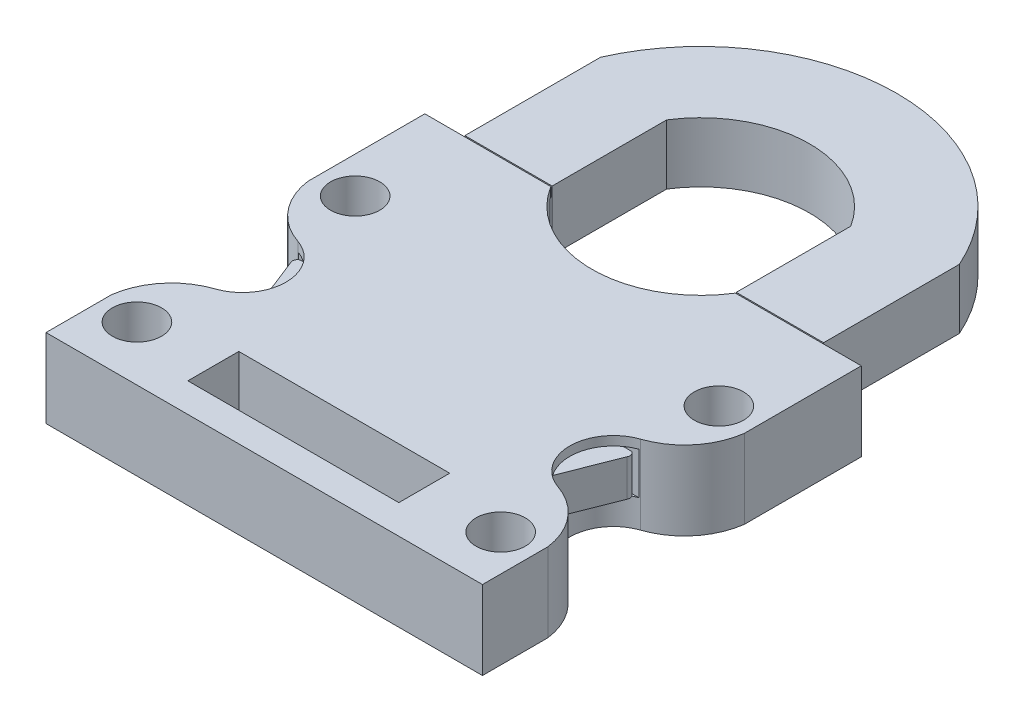
from build123d import *
from build123d.topology import SkipClean

# Parameters (mm, degrees)
SKETCH1_R                = 2.75
BOSS_EXTRUDE1_DEPTH      = 10.6045
SKETCH2_R                = 4.3
CUT_EXTRUDE1_DEPTH       = 7
SKETCH3_W                = 9.525
SKETCH3_H                = 7.4295
CUT_EXTRUDE2_DEPTH       = 30.5816
CUT_EXTRUDE5_REACH       = 87.614
SKETCH4_W                = 14.26
SKETCH4_H                = 7.4295
CUT_EXTRUDE6_DEPTH       = 3.71475
CUT_EXTRUDE7_DEPTH       = 5.715
MIRROR5_COPY_1_DEPTH     = 5.715
BOSS_EXTRUDE3_DEPTH      = 3.26
BOSS_EXTRUDE3_DEPTH_BACK = 3.16
CUT_EXTRUDE8_DEPTH       = 91.912226505
BOSS_EXTRUDE4_START      = 2.04225
BOSS_EXTRUDE4_DEPTH      = 2.04225
SKETCH13_W               = 36.83
SKETCH13_H               = 8.89
CUT_EXTRUDE10_DEPTH      = 91.912226505
SKETCH16_W               = 2.54
SKETCH16_H               = 7.4295
CUT_EXTRUDE11_DEPTH      = 12.7
FILLET1_R                = 10
FILLET3_R                = 1.27
BOSS_EXTRUDE5_DEPTH      = 0.1
BOSS_EXTRUDE5_DEPTH_BACK = 4.7475
SKETCH20_R               = 2.75
SKETCH20_W               = 36.83
SKETCH20_H               = 8.89
BOSS_EXTRUDE6_START      = 2
BOSS_EXTRUDE6_DEPTH      = 2


with BuildPart() as part:
    # Sketch1 → Boss-Extrude1 (new body)
    with BuildSketch(Plane(origin=(0, 0, 0), x_dir=(1, 0, 0), z_dir=(0, 1, 0))):
        with BuildLine():
            Line((-38.1, -28.575), (38.1, -28.575))
            Line((38.1, -28.575), (38.1, 37.561502049))
            Line((38.1, 37.561502049), (15.875, 37.561502049))
            ThreePointArc((15.875, 37.561502049), (0, 28.829), (-15.875, 37.561502049))
            Line((-15.875, 37.561502049), (-38.1, 37.561502049))
            Line((-38.1, 37.561502049), (-38.1, -28.575))
        make_face()
        with Locations(Location((-31.75, 19.05, 0), (0, 0, 270))):
            Circle(SKETCH1_R, mode=Mode.SUBTRACT)
        with Locations(Location((31.75, 19.05, 0), (0, 0, 270))):
            Circle(SKETCH1_R, mode=Mode.SUBTRACT)
        with Locations(Location((31.75, -19.05, 0), (0, 0, 270))):
            Circle(SKETCH1_R, mode=Mode.SUBTRACT)
        with Locations(Location((-31.75, -19.05, 0), (0, 0, 270))):
            Circle(SKETCH1_R, mode=Mode.SUBTRACT)
    extrude(amount=BOSS_EXTRUDE1_DEPTH)

    # Sketch2 → Cut-Extrude1 (cut)
    with BuildSketch(Plane(origin=(0, 10.6045, 0), x_dir=(1, 0, 0), z_dir=(0, 1, 0))):
        with Locations(Location((-31.75, 19.05, 0), (0, 0, 270))):
            Circle(SKETCH2_R)
        with Locations(Location((31.75, 19.05, 0), (0, 0, 270))):
            Circle(SKETCH2_R)
        with Locations(Location((31.75, -19.05, 0), (0, 0, 270))):
            Circle(SKETCH2_R)
        with Locations(Location((-31.75, -19.05, 0), (0, 0, 270))):
            Circle(SKETCH2_R)
    extrude(amount=-CUT_EXTRUDE1_DEPTH, mode=Mode.SUBTRACT)

    # Sketch3 → Cut-Extrude2 (cut)
    with BuildSketch(Plane(origin=(0, 0, -37.561502049), x_dir=(-1, 0, 0), z_dir=(0, 0, -1))):
        with Locations((20.6375, 5.30225)):
            Rectangle(SKETCH3_W, SKETCH3_H)
    cut_extrude2 = extrude(amount=-CUT_EXTRUDE2_DEPTH, mode=Mode.SUBTRACT)

    # Mirror1: Cut-Extrude2 across plane
    add(cut_extrude2.mirror(Plane(origin=(0, 0, 0), x_dir=(0, 0, 1), z_dir=(1, 0, 0))), mode=Mode.SUBTRACT)

    # Sketch4 → Cut-Extrude5 (cut, up to next)
    with BuildSketch(Plane.ZY.offset(38.1), mode=Mode.PRIVATE) as cut_extrude5_sk1:
        with Locations((0, 5.30225)):
            Rectangle(SKETCH4_W, SKETCH4_H)
    cut_extrude5_tool1 = extrude(cut_extrude5_sk1.sketch, amount=-CUT_EXTRUDE5_REACH, mode=Mode.PRIVATE) & part.part
    add(cut_extrude5_tool1.solids().sort_by_distance((-38.1, 5.30225, 0))[0], mode=Mode.SUBTRACT)

    # Sketch6 → Cut-Extrude6 (cut, symmetric)
    with BuildSketch(Plane(origin=(0, 5.30225, 0), x_dir=(1, 0, 0), z_dir=(0, 1, 0))):
        with BuildLine():
            Line((15.875, 33.369851071), (15.875, 7.13))
            Line((15.875, 7.13), (9.525, 7.13))
            Line((9.525, 7.13), (9.525, 28.533136))
            ThreePointArc((9.525, 28.533136), (12.928203787, 30.651890596), (15.875, 33.369851071))
        make_face()
    cut_extrude6 = extrude(amount=CUT_EXTRUDE6_DEPTH, both=True, mode=Mode.SUBTRACT)

    # Mirror3: Cut-Extrude6 across plane
    add(cut_extrude6.mirror(Plane(origin=(0, 0, 0), x_dir=(0, 0, 1), z_dir=(1, 0, 0))), mode=Mode.SUBTRACT)

    # Sketch7 → Cut-Extrude7 (cut, symmetric)
    with BuildSketch(Plane(origin=(0, 5.30225, 0), x_dir=(1, 0, 0), z_dir=(0, 1, 0))):
        with BuildLine():
            Line((-38.1, 17.145), (-38.1, 0))
            Line((-38.1, 0), (-24.765, 0))
            ThreePointArc((-24.765, 0), (-26.190968756, 4.438285361), (-29.935177676, 7.215453595))
            ThreePointArc((-29.935177676, 7.215453595), (-35.432627538, 11.016675202), (-38.1, 17.145))
        make_face()
    cut_extrude7 = extrude(amount=CUT_EXTRUDE7_DEPTH, both=True, mode=Mode.SUBTRACT)

    # Mirror4: Cut-Extrude7 across plane
    add(cut_extrude7.mirror(Plane(origin=(0, 0, 0), x_dir=(0, 0, 1), z_dir=(1, 0, 0))), mode=Mode.SUBTRACT)

    # Mirror5: Cut-Extrude7 across plane
    add(cut_extrude7.mirror(Plane.XY), mode=Mode.SUBTRACT)

    # Mirror5 copy 1 sketch → Mirror5 copy 1 (cut, symmetric)
    with BuildSketch(Plane(origin=(0, 5.30225, 0), x_dir=(-1, 0, 0), z_dir=(0, 1, 0))):
        with BuildLine():
            Line((-38.1, 17.145), (-38.1, 0))
            Line((-38.1, 0), (-24.765, 0))
            ThreePointArc((-24.765, 0), (-26.190968756, 4.438285361), (-29.935177676, 7.215453595))
            ThreePointArc((-29.935177676, 7.215453595), (-35.432627538, 11.016675202), (-38.1, 17.145))
        make_face()
    extrude(amount=MIRROR5_COPY_1_DEPTH, both=True, mode=Mode.SUBTRACT)

    # Sketch10 → Cut-Extrude8 (cut, through all)
    with BuildSketch(Plane(origin=(0, 10.6045, 0), x_dir=(1, 0, 0), z_dir=(0, 1, 0))):
        with BuildLine():
            Line((-16.0734375, 37.561502049), (-16.0734375, 37.504068083))
            ThreePointArc((-16.0734375, 37.504068083), (0, 28.6305625), (16.0734375, 37.504068083))
            Line((16.0734375, 37.504068083), (16.0734375, 37.561502049))
            Line((16.0734375, 37.561502049), (-16.0734375, 37.561502049))
        make_face()
    extrude(amount=-CUT_EXTRUDE8_DEPTH, mode=Mode.SUBTRACT)

    # Sketch13 → Cut-Extrude10 (cut, through all)
    with BuildSketch(Plane(origin=(0, 10.6045, 0), x_dir=(1, 0, 0), z_dir=(0, 1, 0))):
        with Locations((0, -19.05)):
            Rectangle(SKETCH13_W, SKETCH13_H)
    extrude(amount=-CUT_EXTRUDE10_DEPTH, mode=Mode.SUBTRACT)

    # Sketch16 → Cut-Extrude11 (cut)
    with BuildSketch(Plane(origin=(0, 0, -37.561502049), x_dir=(-1, 0, 0), z_dir=(0, 0, -1))):
        with Locations((26.67, 5.30225)):
            Rectangle(SKETCH16_W, SKETCH16_H)
    cut_extrude11 = extrude(amount=-CUT_EXTRUDE11_DEPTH, mode=Mode.SUBTRACT)

    # Mirror6: Cut-Extrude11 across plane
    add(cut_extrude11.mirror(Plane(origin=(0, 0, 0), x_dir=(0, 0, 1), z_dir=(1, 0, 0))), mode=Mode.SUBTRACT)

    # Fillet1
    # the kernel refuses this fillet: 10 mm, written as the material it takes off along each edge
    with BuildSketch(Plane(origin=(25.4, 9.017, -24.861502049), x_dir=(0, 0, 1), z_dir=(0, -1, 0))) as fillet1_piece_1:
        with BuildLine():
            CenterArc((6.659459438, -10), FILLET1_R, 90, 41.754936598)
            Line((0, -2.54), (0, 0))
            Line((0, 0), (6.659459438, 0))
        make_face()
    extrude(amount=7.4295, mode=Mode.SUBTRACT)
    with BuildSketch(Plane(origin=(-25.4, 9.017, -24.861502049), x_dir=(-1, 0, 0), z_dir=(0, -1, 0))) as fillet1_piece_2:
        with BuildLine():
            CenterArc((10, -6.659459438), FILLET1_R, 138.245063402, 41.754936598)
            Line((0, -6.659459438), (0, 0))
            Line((0, 0), (2.54, 0))
        make_face()
    extrude(amount=7.4295, mode=Mode.SUBTRACT)

    # Sketch20 → Boss-Extrude5 (add, two sides: drawn at the far end of the back side and taken through both)
    with SkipClean():  # the faces are left unmerged after this step: merging them gives an invalid solid
        with BuildSketch(Plane(origin=(0, 1.5875, 0), x_dir=(1, 0, 0), z_dir=(0, 1, 0)).offset(-BOSS_EXTRUDE5_DEPTH_BACK)):
            with BuildLine():
                Line((16.0734375, 37.561502049), (16.0734375, 37.504068083))
                ThreePointArc((16.0734375, 37.504068083), (0, 28.6305625), (-16.0734375, 37.504068083))
                Line((-16.0734375, 37.504068083), (-16.0734375, 37.561502049))
                Line((-16.0734375, 37.561502049), (-38.1, 37.561502049))
                Line((-38.1, 37.561502049), (-38.1, 17.145))
                ThreePointArc((-38.1, 17.145), (-35.432627538, 11.016675202), (-29.935177676, 7.215453595))
                ThreePointArc((-29.935177676, 7.215453595), (-24.765, 0), (-29.935177676, -7.215453595))
                ThreePointArc((-29.935177676, -7.215453595), (-35.432627538, -11.016675202), (-38.1, -17.145))
                Line((-38.1, -17.145), (-38.1, -28.575))
                Line((-38.1, -28.575), (38.1, -28.575))
                Line((38.1, -28.575), (38.1, -17.145))
                ThreePointArc((38.1, -17.145), (35.432627538, -11.016675202), (29.935177676, -7.215453595))
                ThreePointArc((29.935177676, -7.215453595), (24.765, 0), (29.935177676, 7.215453595))
                ThreePointArc((29.935177676, 7.215453595), (35.432627538, 11.016675202), (38.1, 17.145))
                Line((38.1, 17.145), (38.1, 37.561502049))
                Line((38.1, 37.561502049), (16.0734375, 37.561502049))
            make_face()
            with Locations(Location((-31.75, 19.05, 0), (0, 0, 270))):
                Circle(SKETCH20_R, mode=Mode.SUBTRACT)
            with Locations(Location((31.75, 19.05, 0), (0, 0, 270))):
                Circle(SKETCH20_R, mode=Mode.SUBTRACT)
            with Locations(Location((-31.75, -19.05, 0), (0, 0, 270))):
                Circle(SKETCH20_R, mode=Mode.SUBTRACT)
            with Locations(Location((31.75, -19.05, 0), (0, 0, 270))):
                Circle(SKETCH20_R, mode=Mode.SUBTRACT)
            with Locations((0, -19.05)):
                Rectangle(SKETCH20_W, SKETCH20_H, mode=Mode.SUBTRACT)
        extrude(amount=BOSS_EXTRUDE5_DEPTH + BOSS_EXTRUDE5_DEPTH_BACK)


with BuildPart() as body_2:
    # Sketch8 → Boss-Extrude3 (new, two sides: drawn at the far end of the back side and taken through both)
    with BuildSketch(Plane(origin=(0, 5.30225, 0), x_dir=(1, 0, 0), z_dir=(0, 1, 0)).offset(-BOSS_EXTRUDE3_DEPTH_BACK)):
        with BuildLine():
            Line((16.0734375, 37.759939549), (16.0734375, 57.745931917))
            ThreePointArc((16.0734375, 57.745931917), (0, 66.6194375), (-16.0734375, 57.745931917))
            Line((-16.0734375, 57.745931917), (-16.0734375, 37.759939549))
            Line((-16.0734375, 37.759939549), (-20.193, 37.759939549))
            Line((-20.193, 37.759939549), (-20.193, -2.894153135))
            ThreePointArc((-20.193, -2.894153135), (-22.507321082, -5.688326081), (-25.683593638, -3.934821824))
            Line((-25.683593638, -3.934821824), (-29.361266441, 5.418397444))
            ThreePointArc((-29.361266441, 5.418397444), (-29.411512587, 6.105346033), (-28.956, 6.622))
            Line((-28.956, 6.622), (-24.638, 6.622))
            Line((-24.638, 6.622), (-24.638, 37.759939549))
            Line((-24.638, 37.759939549), (-31.3134375, 37.759939549))
            Line((-31.3134375, 37.759939549), (-31.3134375, 61.462100234))
            ThreePointArc((-31.3134375, 61.462100234), (0, 81.8594375), (31.3134375, 61.462100234))
            Line((31.3134375, 61.462100234), (31.3134375, 37.759939549))
            Line((31.3134375, 37.759939549), (24.638, 37.759939549))
            Line((24.638, 37.759939549), (24.638, 6.622))
            Line((24.638, 6.622), (28.956, 6.622))
            ThreePointArc((28.956, 6.622), (29.411512587, 6.105346033), (29.361266441, 5.418397444))
            Line((29.361266441, 5.418397444), (25.683593638, -3.934821824))
            ThreePointArc((25.683593638, -3.934821824), (22.507321082, -5.688326081), (20.193, -2.894153135))
            Line((20.193, -2.894153135), (20.193, 37.759939549))
            Line((20.193, 37.759939549), (16.0734375, 37.759939549))
        make_face()
    extrude(amount=BOSS_EXTRUDE3_DEPTH + BOSS_EXTRUDE3_DEPTH_BACK)


with BuildPart() as body_3:
    # Sketch11 → Boss-Extrude4 (new body)
    with BuildSketch(Plane(origin=(0, 8.56225, 0), x_dir=(1, 0, 0), z_dir=(0, 1, 0)).offset(BOSS_EXTRUDE4_START)):
        with BuildLine():
            Line((31.3134375, 37.759939549), (31.3134375, 61.462100234))
            ThreePointArc((31.3134375, 61.462100234), (0, 81.8594375), (-31.3134375, 61.462100234))
            Line((-31.3134375, 61.462100234), (-31.3134375, 37.759939549))
            Line((-31.3134375, 37.759939549), (-16.0734375, 37.759939549))
            Line((-16.0734375, 37.759939549), (-16.0734375, 57.745931917))
            ThreePointArc((-16.0734375, 57.745931917), (0, 66.6194375), (16.0734375, 57.745931917))
            Line((16.0734375, 57.745931917), (16.0734375, 37.759939549))
            Line((16.0734375, 37.759939549), (31.3134375, 37.759939549))
        make_face()
    extrude(amount=-BOSS_EXTRUDE4_DEPTH)

    # Combine1: union body 2
    add(body_2.part)

    # Fillet3
    fillet3_edges = [body_3.edges().sort_by_distance(p)[0] for p in [
        (-24.638, 5.35225, -37.759939549),
        (24.638, 5.35225, -37.759939549),
        (20.193, 5.35225, -37.759939549),
        (-20.193, 5.35225, -37.759939549),
    ]]
    fillet(fillet3_edges, radius=FILLET3_R)

    # Sketch21 → Boss-Extrude6 (add)
    with BuildSketch(Plane.XZ.offset(-2.14225).offset(BOSS_EXTRUDE6_START)):
        with BuildLine():
            Line((-31.3134375, -37.759939549), (-16.0734375, -37.759939549))
            Line((-16.0734375, -37.759939549), (-16.0734375, -57.745931917))
            ThreePointArc((-16.0734375, -57.745931917), (0, -66.6194375), (16.0734375, -57.745931917))
            Line((16.0734375, -57.745931917), (16.0734375, -37.759939549))
            Line((16.0734375, -37.759939549), (31.3134375, -37.759939549))
            Line((31.3134375, -37.759939549), (31.3134375, -61.462100234))
            ThreePointArc((31.3134375, -61.462100234), (0, -81.8594375), (-31.3134375, -61.462100234))
            Line((-31.3134375, -61.462100234), (-31.3134375, -37.759939549))
        make_face()
    extrude(amount=-BOSS_EXTRUDE6_DEPTH)


solid = Compound([part.part, body_3.part])
